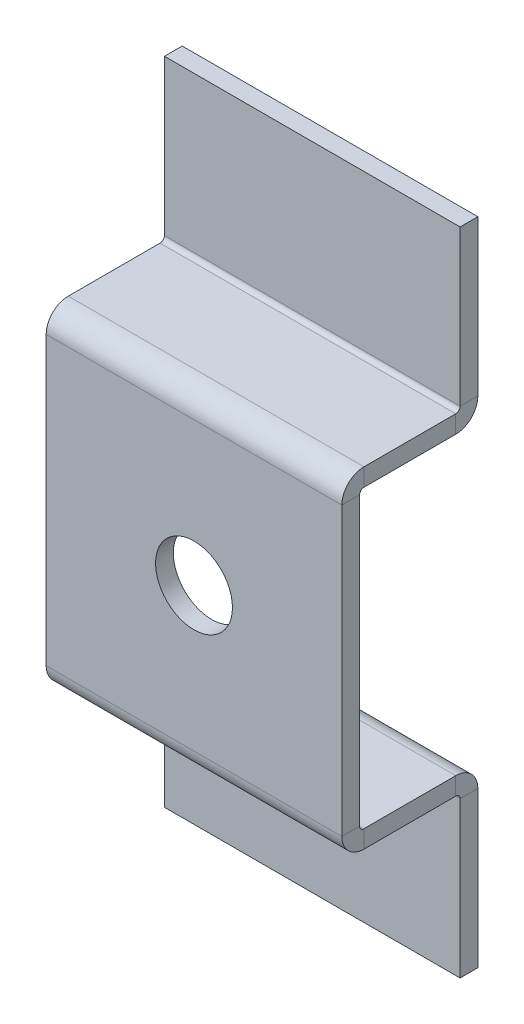
from build123d import *

# Parameters (mm, degrees)
SKETCH_1_W                         = 50
SKETCH_1_H                         = 50
SM_BASE_FLANGE_1_DEPTH             = 3
SM_EDGE_FLANGE_1_STRIP_W           = 13.4732
SM_EDGE_FLANGE_1_STRIP_H           = 3
SM_EDGE_FLANGE_1_STRIP_CUT_DEPTH   = 50
SM_EDGE_FLANGE_1_STRIP_2_W         = 13.4732
SM_EDGE_FLANGE_1_STRIP_2_H         = 3
SM_EDGE_FLANGE_1_STRIP_CUT_2_DEPTH = 50
SM_EDGE_FLANGE_1_DEPTH             = 50
SM_EDGE_FLANGE_1_BEND_DEPTH        = 50
SM_EDGE_FLANGE_2_STRIP_W           = 13.4732
SM_EDGE_FLANGE_2_STRIP_H           = 3
SM_EDGE_FLANGE_2_STRIP_CUT_DEPTH   = 50
SM_EDGE_FLANGE_2_STRIP_2_W         = 13.4732
SM_EDGE_FLANGE_2_STRIP_2_H         = 3
SM_EDGE_FLANGE_2_STRIP_CUT_2_DEPTH = 50
SM_EDGE_FLANGE_2_DEPTH             = 50
SM_EDGE_FLANGE_2_BEND_DEPTH        = 50
SKETCH_18_R                        = 6.5
CUT_EXTRUDE_1_DEPTH                = 98.103038058


# Sheet-metal steps are written as plain solids
with BuildPart() as part:
    # Sketch 1 → 基体-法兰1 (new body)
    with BuildSketch(Plane.XY):
        with Locations((25, 25)):
            Rectangle(SKETCH_1_W, SKETCH_1_H)
    extrude(amount=-SM_BASE_FLANGE_1_DEPTH)

    # 边线-法兰1 strip (across the edge) → 边线-法兰1 strip cut (cut)
    with BuildSketch(Plane(origin=(0, 50, -3), x_dir=(0, -1, 0), z_dir=(1, 0, 0))):
        with Locations((-6, -1.5)):
            Rectangle(SM_EDGE_FLANGE_1_STRIP_W, SM_EDGE_FLANGE_1_STRIP_H)
    extrude(amount=SM_EDGE_FLANGE_1_STRIP_CUT_DEPTH, mode=Mode.SUBTRACT)

    # 边线-法兰1 strip 2 (across the edge) → 边线-法兰1 strip cut 2 (cut)
    with BuildSketch(Plane(origin=(50, 0, -3), x_dir=(0, 1, 0), z_dir=(-1, 0, 0))):
        with Locations((-6, -1.5)):
            Rectangle(SM_EDGE_FLANGE_1_STRIP_2_W, SM_EDGE_FLANGE_1_STRIP_2_H)
    extrude(amount=SM_EDGE_FLANGE_1_STRIP_CUT_2_DEPTH, mode=Mode.SUBTRACT)

    # 边线-法兰1 section (across the edge) → 边线-法兰1 (add)
    with BuildSketch(Plane(origin=(0, 50, -3), x_dir=(0, -1, 0), z_dir=(1, 0, 0))):
        with BuildLine():
            Line((-3, 0.7366), (-3, 17))
            Line((-3, 17), (0, 17))
            Line((0, 17), (0, 0.7366))
            ThreePointArc((0, 0.7366), (0.215745145, 0.215745145), (0.7366, 0))
            Line((0.7366, 0), (0.7366, -3))
            ThreePointArc((0.7366, -3), (-1.905575199, -1.905575199), (-3, 0.7366))
        make_face()
    extrude(amount=SM_EDGE_FLANGE_1_DEPTH)

    # 边线-法兰1 section 2 (across the edge) → 边线-法兰1 bend (add)
    with BuildSketch(Plane(origin=(50, 0, -3), x_dir=(0, 1, 0), z_dir=(-1, 0, 0))):
        with BuildLine():
            Line((-3, 0.7366), (-3, 17))
            Line((-3, 17), (0, 17))
            Line((0, 17), (0, 0.7366))
            ThreePointArc((0, 0.7366), (0.215745145, 0.215745145), (0.7366, 0))
            Line((0.7366, 0), (0.7366, -3))
            ThreePointArc((0.7366, -3), (-1.905575199, -1.905575199), (-3, 0.7366))
        make_face()
    extrude(amount=SM_EDGE_FLANGE_1_BEND_DEPTH)

    # 边线-法兰2 strip (across the edge) → 边线-法兰2 strip cut (cut)
    with BuildSketch(Plane(origin=(0, -3, -20), x_dir=(0, 0, 1), z_dir=(1, 0, 0))):
        with Locations((-6, -1.5)):
            Rectangle(SM_EDGE_FLANGE_2_STRIP_W, SM_EDGE_FLANGE_2_STRIP_H)
    extrude(amount=SM_EDGE_FLANGE_2_STRIP_CUT_DEPTH, mode=Mode.SUBTRACT)

    # 边线-法兰2 strip 2 (across the edge) → 边线-法兰2 strip cut 2 (cut)
    with BuildSketch(Plane(origin=(50, 53, -20), x_dir=(0, 0, 1), z_dir=(-1, 0, 0))):
        with Locations((-6, -1.5)):
            Rectangle(SM_EDGE_FLANGE_2_STRIP_2_W, SM_EDGE_FLANGE_2_STRIP_2_H)
    extrude(amount=SM_EDGE_FLANGE_2_STRIP_CUT_2_DEPTH, mode=Mode.SUBTRACT)

    # 边线-法兰2 section (across the edge) → 边线-法兰2 (add)
    with BuildSketch(Plane(origin=(0, -3, -20), x_dir=(0, 0, 1), z_dir=(1, 0, 0))):
        with BuildLine():
            Line((-3, 0.7366), (-3, 27))
            Line((-3, 27), (0, 27))
            Line((0, 27), (0, 0.7366))
            ThreePointArc((0, 0.7366), (0.215745145, 0.215745145), (0.7366, 0))
            Line((0.7366, 0), (0.7366, -3))
            ThreePointArc((0.7366, -3), (-1.905575199, -1.905575199), (-3, 0.7366))
        make_face()
    extrude(amount=SM_EDGE_FLANGE_2_DEPTH)

    # 边线-法兰2 section 2 (across the edge) → 边线-法兰2 bend (add)
    with BuildSketch(Plane(origin=(50, 53, -20), x_dir=(0, 0, 1), z_dir=(-1, 0, 0))):
        with BuildLine():
            Line((-3, 0.7366), (-3, 27))
            Line((-3, 27), (0, 27))
            Line((0, 27), (0, 0.7366))
            ThreePointArc((0, 0.7366), (0.215745145, 0.215745145), (0.7366, 0))
            Line((0.7366, 0), (0.7366, -3))
            ThreePointArc((0.7366, -3), (-1.905575199, -1.905575199), (-3, 0.7366))
        make_face()
    extrude(amount=SM_EDGE_FLANGE_2_BEND_DEPTH)

    # 草图18 → 切除-拉伸1 (cut, through all)
    with BuildSketch(Plane.XY):
        with Locations((25, 25)):
            Circle(SKETCH_18_R)
    extrude(amount=-CUT_EXTRUDE_1_DEPTH, mode=Mode.SUBTRACT)


solid = part.part
